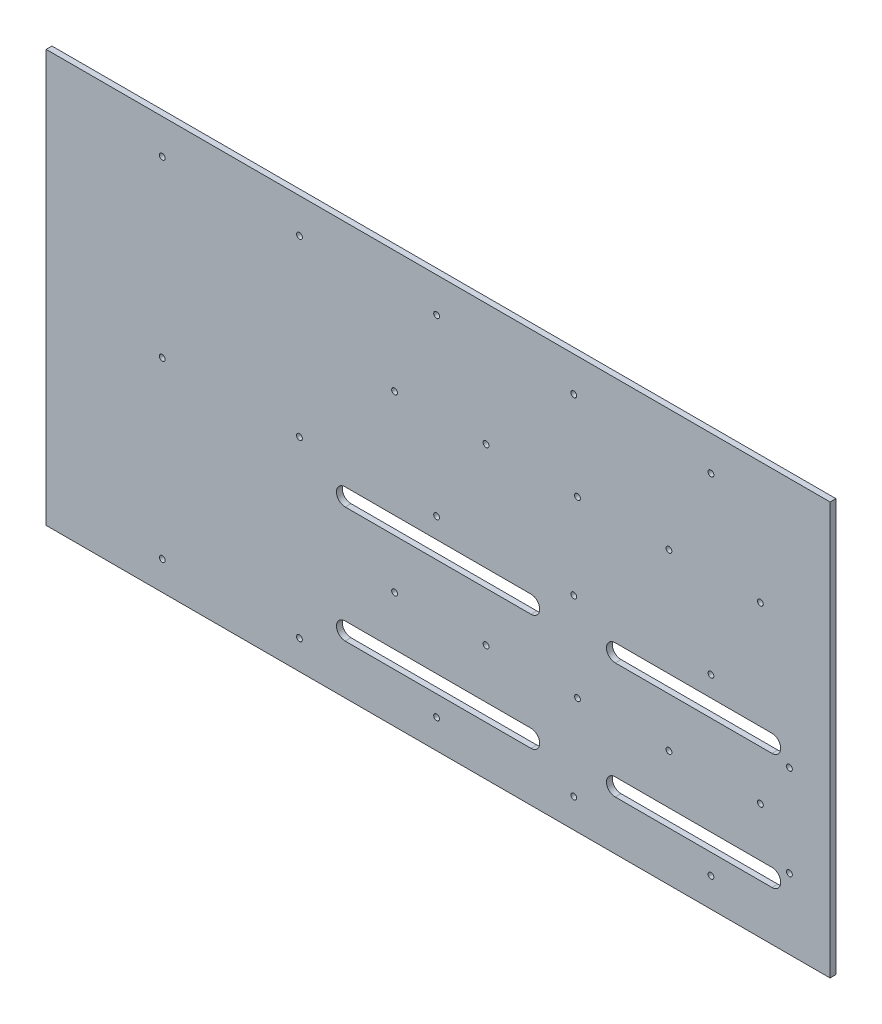
from build123d import *

# Parameters (mm, degrees)
SKETCH1_W           = 857.25
SKETCH1_H           = 450.85
BOSS_EXTRUDE1_DEPTH = 6.35
SKETCH4_R           = 3.175
CUT_EXTRUDE3_DEPTH  = 485.330614095
SKETCH2_R           = 3.175
CUT_EXTRUDE1_DEPTH  = 485.330614095
SKETCH3_R           = 3.175
CUT_EXTRUDE2_DEPTH  = 485.330614095


with BuildPart() as part:
    # Sketch1 → Boss-Extrude1 (new body)
    with BuildSketch(Plane.XY):
        Rectangle(SKETCH1_W, SKETCH1_H)
    extrude(amount=BOSS_EXTRUDE1_DEPTH)

    # Sketch4 → Cut-Extrude3 (cut, through all)
    with BuildSketch(Plane.XY.offset(6.35)):
        with Locations((352.425, 92.075)):
            Circle(SKETCH4_R)
        with Locations((252.425000102, 92.075)):
            Circle(SKETCH4_R)
        with Locations((152.425000204, 92.075)):
            Circle(SKETCH4_R)
        with Locations((52.425000306, 92.075)):
            Circle(SKETCH4_R)
        with Locations((-47.574999592, 92.075)):
            Circle(SKETCH4_R)
        with Locations((352.425, -98.425)):
            Circle(SKETCH4_R)
        with Locations((252.425000102, -98.425)):
            Circle(SKETCH4_R)
        with Locations((152.425000204, -98.425)):
            Circle(SKETCH4_R)
        with Locations((52.425000306, -98.425)):
            Circle(SKETCH4_R)
        with Locations((-47.574999592, -98.425)):
            Circle(SKETCH4_R)
    extrude(amount=-CUT_EXTRUDE3_DEPTH, mode=Mode.SUBTRACT)

    # Sketch2 → Cut-Extrude1 (cut, through all)
    with BuildSketch(Plane.XY.offset(6.35)):
        with Locations((298.3738, -193.675)):
            Circle(SKETCH2_R)
        with Locations((148.373800026, -193.675)):
            Circle(SKETCH2_R)
        with Locations((-1.626199948, -193.675)):
            Circle(SKETCH2_R)
        with Locations((-151.626199922, -193.675)):
            Circle(SKETCH2_R)
        with Locations((-301.626199896, -193.675)):
            Circle(SKETCH2_R)
        with Locations((298.3738, -3.175)):
            Circle(SKETCH2_R)
        with Locations((148.373800026, -3.175)):
            Circle(SKETCH2_R)
        with Locations((-1.626199948, -3.175)):
            Circle(SKETCH2_R)
        with Locations((-151.626199922, -3.175)):
            Circle(SKETCH2_R)
        with Locations((-301.626199896, -3.175)):
            Circle(SKETCH2_R)
        with Locations((298.3738, 187.325)):
            Circle(SKETCH2_R)
        with Locations((148.373800026, 187.325)):
            Circle(SKETCH2_R)
        with Locations((-1.626199948, 187.325)):
            Circle(SKETCH2_R)
        with Locations((-151.626199922, 187.325)):
            Circle(SKETCH2_R)
        with Locations((-301.626199896, 187.325)):
            Circle(SKETCH2_R)
        with BuildLine():
            Line((-101.6, -152.4), (101.6, -152.4))
            ThreePointArc((101.6, -152.4), (111.125, -161.925), (101.6, -171.45))
            Line((101.6, -171.45), (-101.6, -171.45))
            ThreePointArc((-101.6, -171.45), (-111.125, -161.925), (-101.6, -152.4))
        make_face()
        with BuildLine():
            Line((193.675, -152.4), (365.125, -152.4))
            ThreePointArc((365.125, -152.4), (374.65, -161.925), (365.125, -171.45))
            Line((365.125, -171.45), (193.675, -171.45))
            ThreePointArc((193.675, -171.45), (184.15, -161.925), (193.675, -152.4))
        make_face()
        with BuildLine():
            Line((365.125, -44.45), (193.675, -44.45))
            ThreePointArc((193.675, -44.45), (184.15, -34.925), (193.675, -25.4))
            Line((193.675, -25.4), (365.125, -25.4))
            ThreePointArc((365.125, -25.4), (374.65, -34.925), (365.125, -44.45))
        make_face()
        with BuildLine():
            Line((101.6, -44.45), (-101.6, -44.45))
            ThreePointArc((-101.6, -44.45), (-111.125, -34.925), (-101.6, -25.4))
            Line((-101.6, -25.4), (101.6, -25.4))
            ThreePointArc((101.6, -25.4), (111.125, -34.925), (101.6, -44.45))
        make_face()
    extrude(amount=-CUT_EXTRUDE1_DEPTH, mode=Mode.SUBTRACT)

    # Sketch3 → Cut-Extrude2 (cut, through all)
    with BuildSketch(Plane.XY.offset(6.35)):
        with Locations((384.175, -148.425000076)):
            Circle(SKETCH3_R)
        with Locations((384.175, -48.424999924)):
            Circle(SKETCH3_R)
    extrude(amount=-CUT_EXTRUDE2_DEPTH, mode=Mode.SUBTRACT)


solid = part.part
